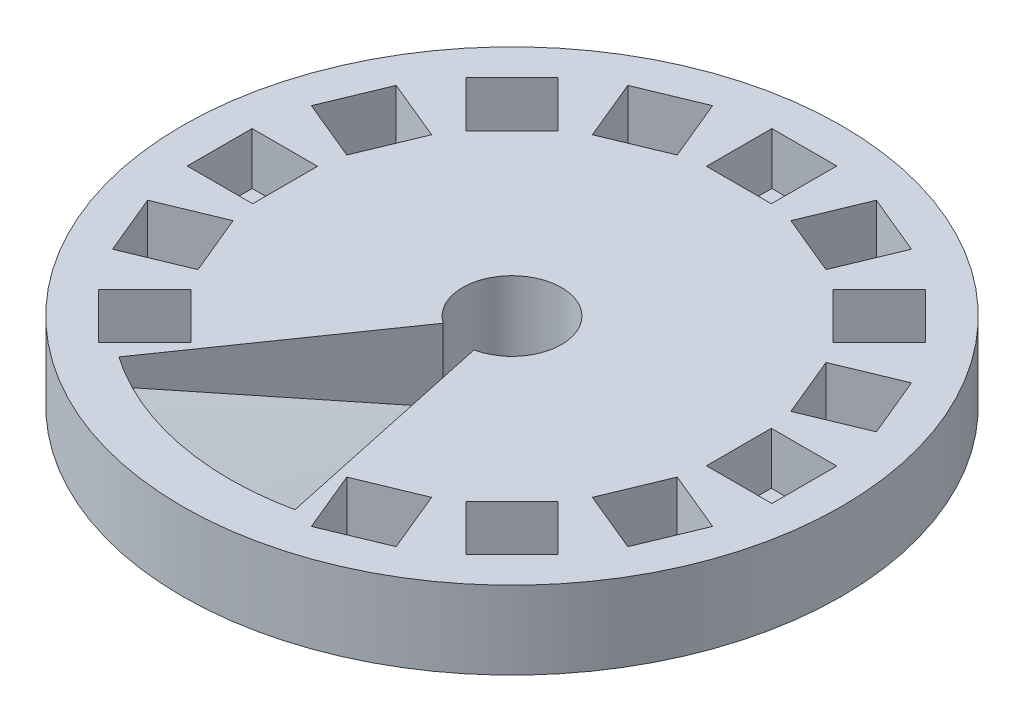
from build123d import *

# Parameters (mm, degrees)
SKETCH3_W          = 12.5
SKETCH3_H          = 12.6
CUT_EXTRUDE1_DEPTH = 10
CIRPATTERN1_COUNT  = 16
CUT_SWEEP3_ANGLE   = 46.890766
SKETCH8_R          = 27
SKETCH8_R_2        = 19.043703719
CUT_EXTRUDE2_DEPTH = 1.85


# Read off the part's stored shape, not the designer's step: Cut-Sweep3
with BuildPart() as part:
    # Sketch1 → Revolve1 (revolve)
    with BuildSketch(Plane(origin=(0, 0, 0), x_dir=(0, 0, -1), z_dir=(1, 0, 0))):
        Polygon((9.525, 0), (63.5, 0), (63.5, -15), (19.047086271, -15), (19.047086271, -34.735580232), (16.547086271, -34.735580232), (16.547086271, -37.235580232), (19.047086271, -37.235580232), (19.047086271, -40.235580232), (4.528779807, -52.235580232), (3.1, -52.235580232), (9.525, -40), align=None)
    revolve(axis=Axis((0, 0, 0), (0, 1, 0)))

    # Sketch3 → Cut-Extrude1 (cut)
    with BuildSketch(Plane(origin=(0, 0, 0), x_dir=(1, 0, 0), z_dir=(0, 1, 0))):
        with Locations((0, 50)):
            Rectangle(SKETCH3_W, SKETCH3_H)
    cut_extrude1 = extrude(amount=-CUT_EXTRUDE1_DEPTH, mode=Mode.SUBTRACT)

    # CirPattern1: Cut-Extrude1 ×16 about axis, 2 skipped
    cirpattern1_axis = Axis((0, 0, 0), (0, -1, 0))
    add([cut_extrude1.rotate(cirpattern1_axis, i * 360 / CIRPATTERN1_COUNT) for i in range(1, CIRPATTERN1_COUNT) if i not in (8, 9)], mode=Mode.SUBTRACT)

    # Cut-Sweep3 outline → Cut-Sweep3 (revolve, cut)
    with BuildSketch(Plane(origin=(0, 0, 0), x_dir=(-0.5705578043075098, 0, 0.8212574455941287), z_dir=(-0.8212574455941287, 0, -0.5705578043075098))):
        Polygon((54.406189133, -5), (54.406189133, 0), (9.525, 0), (9.525, -14.035371812), align=None)
    revolve(axis=Axis((0, 0, 0), (0, 1, 0)), revolution_arc=CUT_SWEEP3_ANGLE, mode=Mode.SUBTRACT)

    # Sketch8 → Cut-Extrude2 (cut)
    with BuildSketch(Plane.XZ.offset(15)):
        with Locations(Location((0, 0, 0), (0, 0, 270))):
            Circle(SKETCH8_R)
        with Locations(Location((0, 0, 0), (0, 0, 270))):
            Circle(SKETCH8_R_2, mode=Mode.SUBTRACT)
    extrude(amount=-CUT_EXTRUDE2_DEPTH, mode=Mode.SUBTRACT)


solid = part.part
